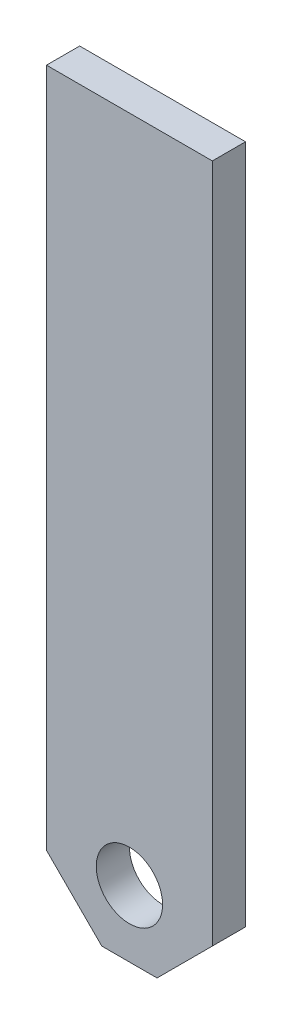
from build123d import *

# Parameters (mm, degrees)
SKETCH_1_W          = 30
SKETCH_1_H          = 133
EXTRUDE_1_DEPTH     = 6
CHAMFER_1_SIZE      = 10
SKETCH_2_R          = 6
CUT_EXTRUDE_1_DEPTH = 134.97761007


with BuildPart() as part:
    # Эскиз1 → Бобышка-Вытянуть1 (new body)
    with BuildSketch(Plane.XY):
        with Locations((0, -66.5)):
            Rectangle(SKETCH_1_W, SKETCH_1_H)
    extrude(amount=-EXTRUDE_1_DEPTH)

    # Фаска1
    chamfer_1_edges = [part.edges().sort_by_distance(p)[0] for p in [
        (-15, -133, -3),
        (15, -133, -3),
    ]]
    chamfer(chamfer_1_edges, length=CHAMFER_1_SIZE)

    # Эскиз2 → Вырез-Вытянуть1 (cut, through all)
    with BuildSketch(Plane.XY):
        with Locations((0, -121)):
            Circle(SKETCH_2_R)
    extrude(amount=-CUT_EXTRUDE_1_DEPTH, mode=Mode.SUBTRACT)


solid = part.part
